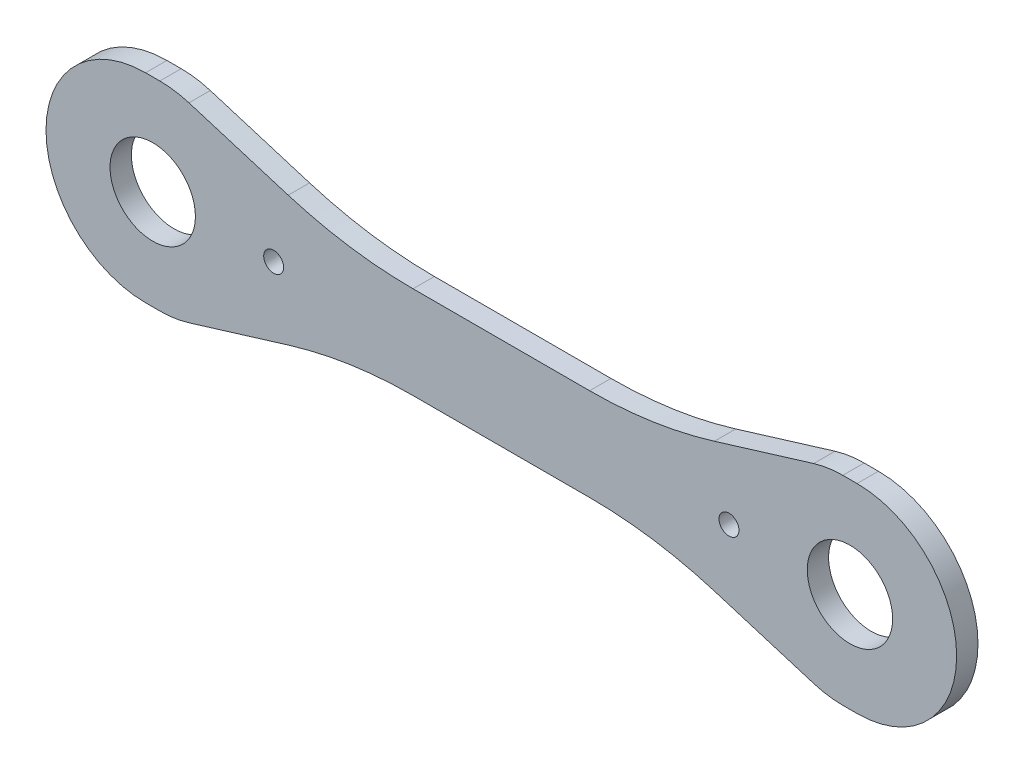
from build123d import *

# Parameters (mm, degrees)
EXTRUDE1_DEPTH         = 15
SKETCH2_R              = 30
F_60_UDBORINGER_DEPTH  = 328.910048641
SKETCH3_R              = 7
M16_GEVINDHULLER_DEPTH = 328.910048641


with BuildPart() as part:
    # Sketch1 → Extrude1 (new body)
    with BuildSketch(Plane.XY):
        with BuildLine():
            Line((-250, 70), (-240, 70))
            ThreePointArc((-240, 70), (-229.653341221, 69.231110435), (-219.533980669, 66.941332917))
            Line((-219.533980669, 66.941332917), (-149.757667724, 45.608573211))
            ThreePointArc((-149.757667724, 45.608573211), (-106.388979647, 35.795240991), (-62.046156308, 32.5))
            Line((-62.046156308, 32.5), (62.046156308, 32.5))
            ThreePointArc((62.046156308, 32.5), (106.388979647, 35.795240991), (149.757667724, 45.608573211))
            Line((149.757667724, 45.608573211), (219.533980669, 66.941332917))
            ThreePointArc((219.533980669, 66.941332917), (229.653341221, 69.231110435), (240, 70))
            Line((240, 70), (250, 70))
            ThreePointArc((250, 70), (320, 0), (250, -70))
            Line((250, -70), (240, -70))
            ThreePointArc((240, -70), (229.653341221, -69.231110435), (219.533980669, -66.941332917))
            Line((219.533980669, -66.941332917), (149.757667724, -45.608573211))
            ThreePointArc((149.757667724, -45.608573211), (106.388979647, -35.795240991), (62.046156308, -32.5))
            Line((62.046156308, -32.5), (-62.046156308, -32.5))
            ThreePointArc((-62.046156308, -32.5), (-106.388979647, -35.795240991), (-149.757667724, -45.608573211))
            Line((-149.757667724, -45.608573211), (-219.533980669, -66.941332917))
            ThreePointArc((-219.533980669, -66.941332917), (-229.653341221, -69.231110435), (-240, -70))
            Line((-240, -70), (-250, -70))
            ThreePointArc((-250, -70), (-320, 0), (-250, 70))
        make_face()
    extrude(amount=EXTRUDE1_DEPTH)

    # Sketch2 → ø60 udboringer (cut, through all)
    with BuildSketch(Plane.XY.offset(15)):
        with Locations((245, 0)):
            Circle(SKETCH2_R)
        with Locations((-245, 0)):
            Circle(SKETCH2_R)
    extrude(amount=-F_60_UDBORINGER_DEPTH, mode=Mode.SUBTRACT)

    # Sketch3 → M16 gevindhuller (cut, through all)
    with BuildSketch(Plane.XY.offset(15)):
        with Locations((160, 0)):
            Circle(SKETCH3_R)
        with Locations((-160, 0)):
            Circle(SKETCH3_R)
    extrude(amount=-M16_GEVINDHULLER_DEPTH, mode=Mode.SUBTRACT)


solid = part.part
